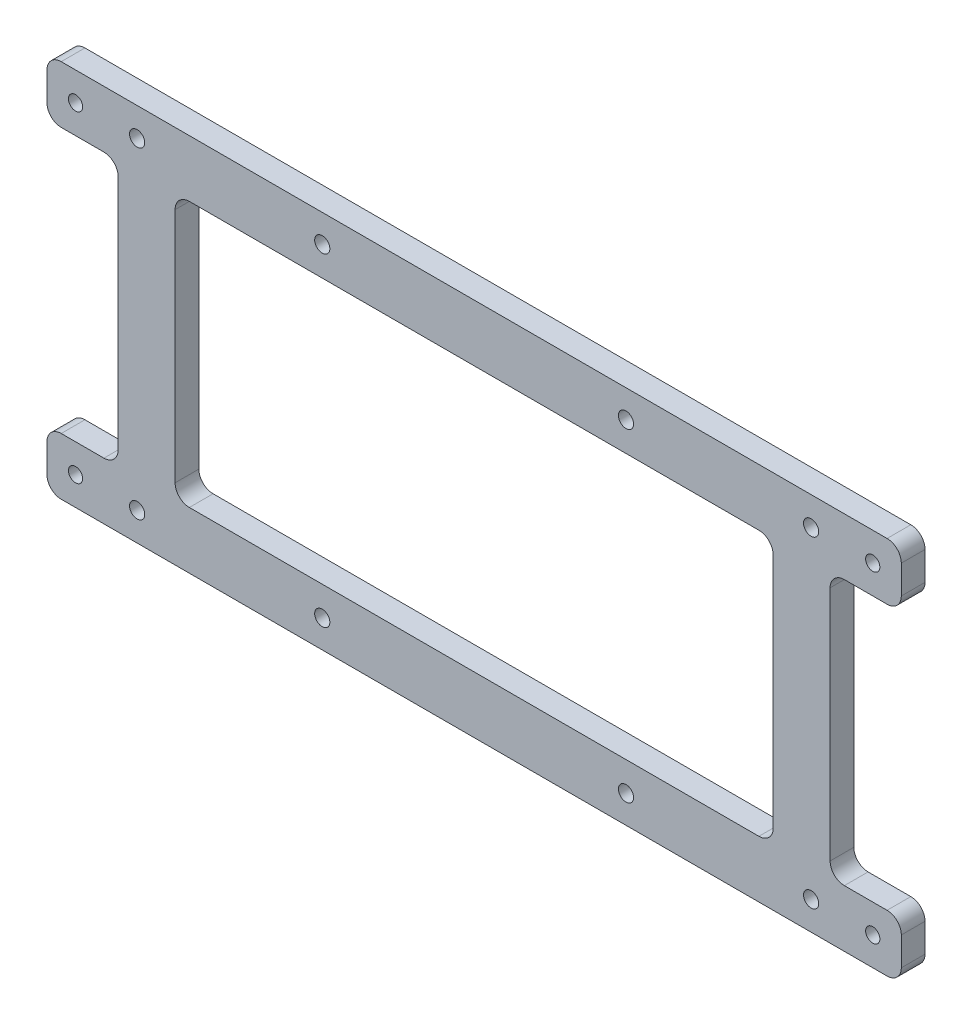
from build123d import *

# Parameters (mm, degrees)
EXTRUDE_1_DEPTH     = 5
FILLET_1_R          = 3
SKETCH_2_R          = 1.5
SKETCH_2_R_2        = 1.6
CUT_EXTRUDE_1_DEPTH = 7


with BuildPart() as part:
    # 草图1 → 凸台-拉伸1 (new body)
    with BuildSketch(Plane.XY):
        with BuildLine():
            Line((-20, 27.843243592), (-8, 27.843243592))
            Line((-8, 27.843243592), (-8, -28))
            Line((-8, -28), (-20, -28))
            ThreePointArc((-20, -28), (-22.121320344, -28.878679656), (-23, -31))
            Line((-23, -31), (-23, -37))
            ThreePointArc((-23, -37), (-22.121320344, -39.121320344), (-20, -40))
            Line((-20, -40), (154, -40))
            ThreePointArc((154, -40), (156.121320344, -39.121320344), (157, -37))
            Line((157, -37), (157, -31))
            ThreePointArc((157, -31), (156.121320344, -28.878679656), (154, -28))
            Line((154, -28), (142, -28))
            Line((142, -28), (142, 27.843243592))
            Line((142, 27.843243592), (154, 27.843243592))
            ThreePointArc((154, 27.843243592), (156.121320344, 28.721923248), (157, 30.843243592))
            Line((157, 30.843243592), (157, 36.843243592))
            ThreePointArc((157, 36.843243592), (156.121320344, 38.964563935), (154, 39.843243592))
            Line((154, 39.843243592), (142, 39.843243592))
            Line((142, 39.843243592), (-8, 39.843243592))
            Line((-8, 39.843243592), (-20, 39.843243592))
            ThreePointArc((-20, 39.843243592), (-22.121320344, 38.964563935), (-23, 36.843243592))
            Line((-23, 36.843243592), (-23, 30.843243592))
            ThreePointArc((-23, 30.843243592), (-22.121320344, 28.721923248), (-20, 27.843243592))
        make_face()
        with BuildLine():
            ThreePointArc((4, 24.843243592), (4.878679656, 26.964563935), (7, 27.843243592))
            Line((7, 27.843243592), (127, 27.843243592))
            ThreePointArc((127, 27.843243592), (129.121320344, 26.964563935), (130, 24.843243592))
            Line((130, 24.843243592), (130, -25))
            ThreePointArc((130, -25), (129.121320344, -27.121320344), (127, -28))
            Line((127, -28), (7, -28))
            ThreePointArc((7, -28), (4.878679656, -27.121320344), (4, -25))
            Line((4, -25), (4, 24.843243592))
        make_face(mode=Mode.SUBTRACT)
    extrude(amount=EXTRUDE_1_DEPTH)

    # 圆角1
    fillet_1_edges = [part.edges().sort_by_distance(p)[0] for p in [
        (-8, -28, 2.5),
        (-8, 27.843243592, 2.5),
        (142, -28, 2.5),
        (142, 27.843243592, 2.5),
    ]]
    fillet(fillet_1_edges, radius=FILLET_1_R)

    # 草图2 → 切除-拉伸1 (cut)
    with BuildSketch(Plane.XY.offset(5)):
        with Locations((-16.977965312, 33.843243592)):
            Circle(SKETCH_2_R)
        with Locations((-4, 33.843243592)):
            Circle(SKETCH_2_R_2)
        with Locations((35.001599808, 34)):
            Circle(SKETCH_2_R_2)
        with Locations((98.998400192, 34)):
            Circle(SKETCH_2_R_2)
        with Locations((138, 33.843243592)):
            Circle(SKETCH_2_R_2)
        with Locations((150.977965312, 33.843243592)):
            Circle(SKETCH_2_R)
        with Locations((150.977965312, -34)):
            Circle(SKETCH_2_R)
        with Locations((138, -34)):
            Circle(SKETCH_2_R_2)
        with Locations((98.998400192, -34.156756408)):
            Circle(SKETCH_2_R_2)
        with Locations((35.001599808, -34.156756408)):
            Circle(SKETCH_2_R_2)
        with Locations((-4, -34)):
            Circle(SKETCH_2_R_2)
        with Locations((-16.977965312, -34)):
            Circle(SKETCH_2_R)
    extrude(amount=-CUT_EXTRUDE_1_DEPTH, mode=Mode.SUBTRACT)


solid = part.part
